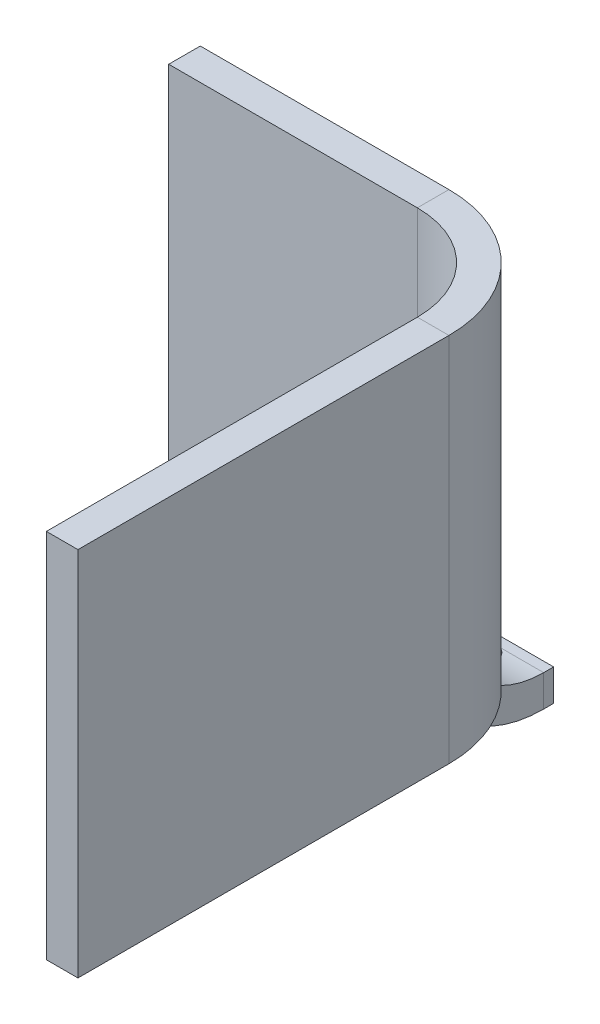
from build123d import *

# Parameters (mm, degrees)
SKETCH1_W                     = 50
SKETCH1_H                     = 2
BASE_FLANGE1_DEPTH            = 6.35
EDGE_FLANGE2_DEPTH            = 50
CBORE_FOR_M3_SHCS1_AT_2_COUNT = 2
CBORE_FOR_M3_SHCS1_AT_2_PITCH = 30
EDGE_FLANGE3_DEPTH            = 74.6
CUT_EXTRUDE2_START            = 10
SKETCH23_R                    = 3.25
CUT_EXTRUDE2_DEPTH            = 10


# Sheet-metal steps are written as plain solids
with BuildPart() as part:
    # Sketch1 → Base-Flange1 (new body)
    with BuildSketch(Plane(origin=(0, 0, 0), x_dir=(1, 0, 0), z_dir=(0, 1, 0))):
        Rectangle(SKETCH1_W, SKETCH1_H)
    extrude(amount=-BASE_FLANGE1_DEPTH)

    # Edge-Flange2 section (across the edge) → Edge-Flange2 (add)
    with BuildSketch(Plane(origin=(-25, 0, 20.05), x_dir=(0, 0, -1), z_dir=(1, 0, 0))):
        with BuildLine():
            Line((-6.35, 19.05), (-6.35, 93.65))
            Line((-6.35, 93.65), (0, 93.65))
            Line((0, 93.65), (0, 19.05))
            ThreePointArc((0, 19.05), (5.579615818, 5.579615818), (19.05, 0))
            Line((19.05, 0), (19.05, -6.35))
            ThreePointArc((19.05, -6.35), (1.089487758, 1.089487758), (-6.35, 19.05))
        make_face()
    extrude(amount=EDGE_FLANGE2_DEPTH)

    # Sketch19 → CBORE for M3 SHCS1 (revolve, cut)
    with BuildSketch(Plane(origin=(-15, 0, 4), x_dir=(0, 0, 1), z_dir=(1, 0, 0))):
        Polygon((0, 0), (0, 6.35), (1.8, 6.35), (1.8, 3), (3.25, 3), (3.25, 0), align=None)
    cbore_for_m3_shcs1 = revolve(axis=Axis((-15, 6.35, 4), (0, -1, 0)), mode=Mode.SUBTRACT)

    # CBORE for M3 SHCS1 at 2: CBORE for M3 SHCS1 ×2
    with Locations(*[(i * CBORE_FOR_M3_SHCS1_AT_2_PITCH, 0, 0) for i in range(1, CBORE_FOR_M3_SHCS1_AT_2_COUNT)]):
        add(cbore_for_m3_shcs1, mode=Mode.SUBTRACT)

    # Edge-Flange3 section (across the edge) → Edge-Flange3 (add)
    with BuildSketch(Plane(origin=(44.05, 19.05, 26.4), x_dir=(-1, 0, 0), z_dir=(0, 1, 0))):
        with BuildLine():
            Line((-6.35, 19.05), (-6.35, 93.65))
            Line((-6.35, 93.65), (0, 93.65))
            Line((0, 93.65), (0, 19.05))
            ThreePointArc((0, 19.05), (5.579615818, 5.579615818), (19.05, 0))
            Line((19.05, 0), (19.05, -6.35))
            ThreePointArc((19.05, -6.35), (1.089487758, 1.089487758), (-6.35, 19.05))
        make_face()
    extrude(amount=EDGE_FLANGE3_DEPTH)

    # Sketch23 → Cut-Extrude2 (cut)
    with BuildSketch(Plane(origin=(0, 0, 0), x_dir=(1, 0, 0), z_dir=(0, 1, 0)).offset(CUT_EXTRUDE2_START)):
        with Locations(Location((15, -4, 0), (0, 0, 270))):
            Circle(SKETCH23_R)
        with Locations(Location((-15, -4, 0), (0, 0, 270))):
            Circle(SKETCH23_R)
    extrude(amount=-CUT_EXTRUDE2_DEPTH, mode=Mode.SUBTRACT)


solid = part.part
